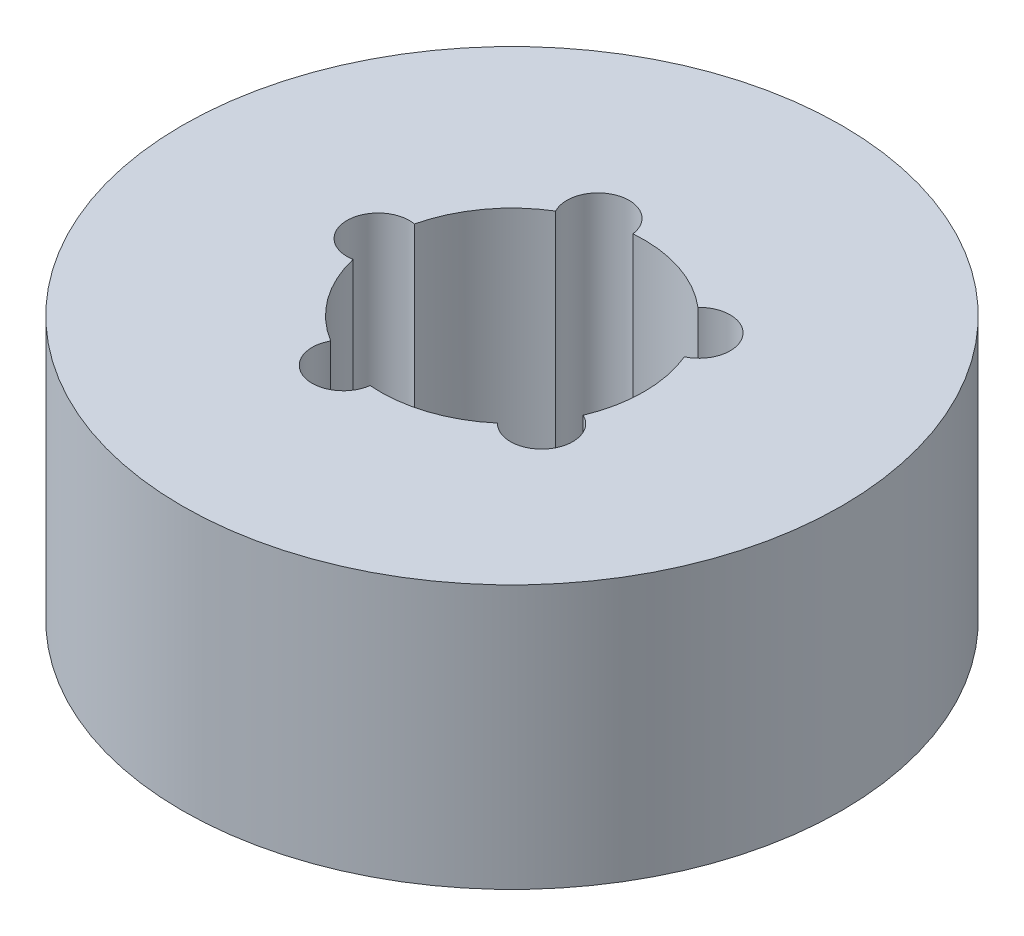
from build123d import *

# Parameters (mm, degrees)
SKETCH1_R           = 25
BOSS_EXTRUDE1_DEPTH = 20
SKETCH2_R           = 10
CUT_EXTRUDE1_DEPTH  = 41.620192023
SKETCH3_R           = 2.365330637
CUT_EXTRUDE2_DEPTH  = 16.717295413
CIRPATTERN1_COUNT   = 5


with BuildPart() as part:
    # Sketch1 → Boss-Extrude1 (new body)
    with BuildSketch(Plane(origin=(0, 0, 0), x_dir=(1, 0, 0), z_dir=(0, 1, 0))):
        Circle(SKETCH1_R)
    extrude(amount=BOSS_EXTRUDE1_DEPTH)

    # Sketch2 → Cut-Extrude1 (cut, through all)
    with BuildSketch(Plane(origin=(0, 0, 0), x_dir=(1, 0, 0), z_dir=(0, 1, 0))):
        Circle(SKETCH2_R)
    extrude(amount=CUT_EXTRUDE1_DEPTH, mode=Mode.SUBTRACT)

    # Sketch3 → Cut-Extrude2 (cut)
    with BuildSketch(Plane(origin=(0, 20, 0), x_dir=(1, 0, 0), z_dir=(0, 1, 0))):
        with Locations((-10.149654885, 0)):
            Circle(SKETCH3_R)
    cut_extrude2 = extrude(amount=-CUT_EXTRUDE2_DEPTH, mode=Mode.SUBTRACT)

    # CirPattern1: Cut-Extrude2 ×5 about axis
    cirpattern1_axis = Axis((0, 0, 0), (0, 1, 0))
    for i in range(1, CIRPATTERN1_COUNT):
        add(cut_extrude2.rotate(cirpattern1_axis, i * 360 / CIRPATTERN1_COUNT), mode=Mode.SUBTRACT)


solid = part.part
